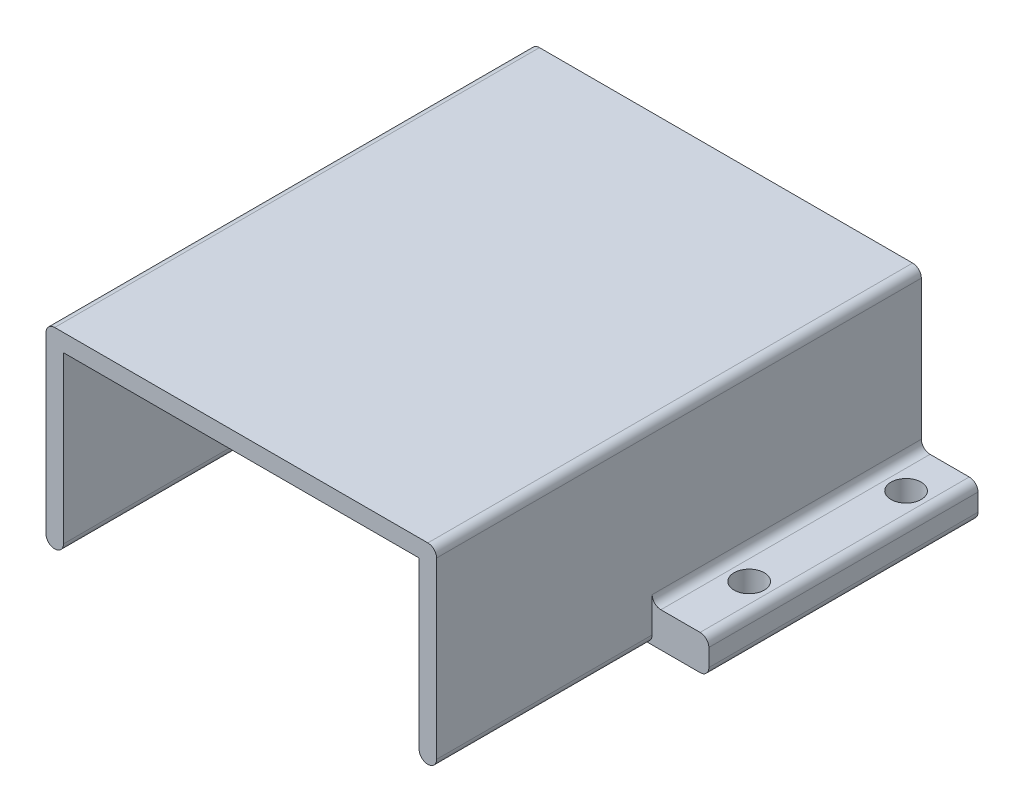
from build123d import *

# Parameters (mm, degrees)
BOSS_EXTRUDE1_DEPTH = 70.612
SKETCH2_R           = 2.2
CUT_EXTRUDE1_DEPTH  = 83.799422419
SKETCH3_W           = 8.255
SKETCH3_H           = 31.401404102
CUT_EXTRUDE2_DEPTH  = 83.799422419
BOSS_EXTRUDE3_DEPTH = 2.54
CUT_EXTRUDE6_DEPTH  = 2.54
SKETCH9_W           = 51.816
SKETCH9_H           = 2.54
CUT_EXTRUDE7_DEPTH  = 2.54
FILLET1_R           = 1.27
FILLET2_R           = 1.27
SKETCH11_W          = 16.51
SKETCH11_H          = 8.89
CUT_EXTRUDE8_DEPTH  = 2.54


with BuildPart() as part:
    # Sketch1 → Boss-Extrude1 (new body)
    with BuildSketch(Plane.XY):
        Polygon((25.908, 25.4), (-25.908, 25.4), (-25.908, 0), (-36.703, 0), (-36.703, 5.08), (-28.448, 5.08), (-28.448, 27.94), (28.448, 27.94), (28.448, 5.08), (36.703, 5.08), (36.703, 0), (25.908, 0), align=None)
    extrude(amount=BOSS_EXTRUDE1_DEPTH)

    # Sketch2 → Cut-Extrude1 (cut, through all)
    with BuildSketch(Plane(origin=(0, 5.08, 0), x_dir=(1, 0, 0), z_dir=(0, 1, 0))):
        with Locations(Location((-32.5755, -6.35, 0), (0, 0, 270))):
            Circle(SKETCH2_R)
        with Locations(Location((-32.5755, -29.21, 0), (0, 0, 270))):
            Circle(SKETCH2_R)
    cut_extrude1 = extrude(amount=-CUT_EXTRUDE1_DEPTH, mode=Mode.SUBTRACT)

    # Mirror1: Cut-Extrude1 across plane
    add(cut_extrude1.mirror(Plane(origin=(0, 0, 0), x_dir=(0, 0, 1), z_dir=(1, 0, 0))), mode=Mode.SUBTRACT)

    # Sketch3 → Cut-Extrude2 (cut, through all)
    with BuildSketch(Plane(origin=(0, 5.08, 0), x_dir=(1, 0, 0), z_dir=(0, 1, 0))):
        with Locations((-32.5755, -54.911297949)):
            Rectangle(SKETCH3_W, SKETCH3_H)
        with Locations((32.5755, -54.911297949)):
            Rectangle(SKETCH3_W, SKETCH3_H)
    extrude(amount=-CUT_EXTRUDE2_DEPTH, mode=Mode.SUBTRACT)

    # Sketch6 → Boss-Extrude3 (add)
    with BuildSketch(Plane(origin=(0, 0, 0), x_dir=(-1, 0, 0), z_dir=(0, 0, -1))):
        Polygon((-25.908, 0), (25.908, 0), (36.703, 0), (36.703, 5.08), (28.448, 5.08), (28.448, 27.94), (-28.448, 27.94), (-28.448, 5.08), (-36.703, 5.08), (-36.703, 0), align=None)
    extrude(amount=-BOSS_EXTRUDE3_DEPTH)

    # Sketch8 → Cut-Extrude6 (cut)
    with BuildSketch(Plane(origin=(0, 0, 0), x_dir=(-1, 0, 0), z_dir=(0, 0, -1))):
        with BuildLine():
            Line((-15.875, 0), (15.875, 0))
            ThreePointArc((15.875, 0), (0, 7.635884934), (-15.875, 0))
        make_face()
    extrude(amount=-CUT_EXTRUDE6_DEPTH, mode=Mode.SUBTRACT)

    # Sketch9 → Cut-Extrude7 (cut)
    with BuildSketch(Plane(origin=(0, 0, 0), x_dir=(-1, 0, 0), z_dir=(0, 0, -1))):
        with Locations((0, 1.27)):
            Rectangle(SKETCH9_W, SKETCH9_H)
    extrude(amount=-CUT_EXTRUDE7_DEPTH, mode=Mode.SUBTRACT)

    # Fillet1
    fillet1_edges = [part.edges().sort_by_distance(p)[0] for p in [
        (-25.908, 0, 35.306),
        (-28.448, 27.94, 35.306),
        (28.448, 27.94, 35.306),
        (25.908, 0, 35.306),
        (-36.703, 0, 19.605297949),
        (-36.703, 5.08, 19.605297949),
        (-28.448, 5.08, 19.605297949),
        (28.448, 5.08, 19.605297949),
        (36.703, 5.08, 19.605297949),
        (36.703, 0, 19.605297949),
        (-28.448, 0, 54.911297949),
        (28.448, 0, 54.911297949),
    ]]
    fillet(fillet1_edges, radius=FILLET1_R - 0.0001)  # a hair under: the kernel refuses the full size

    # Fillet2
    fillet2_edges = [part.edges().sort_by_distance(p)[0] for p in [
        (-25.908, 2.54, 1.27),
        (25.908, 2.54, 1.27),
    ]]
    fillet(fillet2_edges, radius=FILLET2_R)

    # Sketch11 → Cut-Extrude8 (cut)
    with BuildSketch(Plane(origin=(0, 0, 0), x_dir=(-1, 0, 0), z_dir=(0, 0, -1))):
        with Locations((10.16, 18.034)):
            Rectangle(SKETCH11_W, SKETCH11_H)
    extrude(amount=-CUT_EXTRUDE8_DEPTH, mode=Mode.SUBTRACT)


solid = part.part
